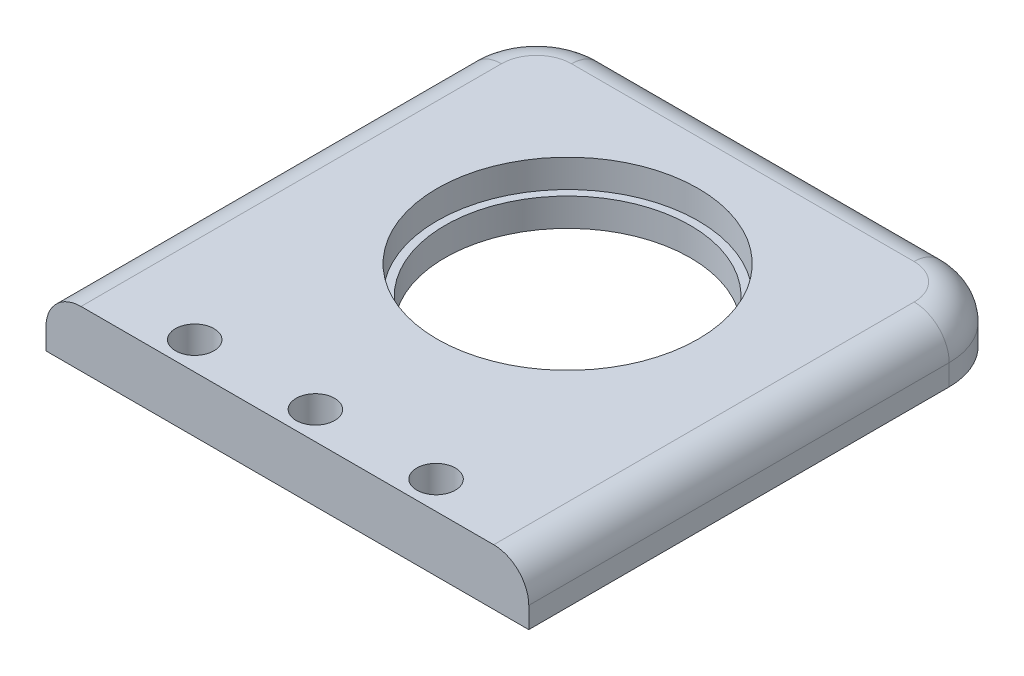
from build123d import *

# Parameters (mm, degrees)
SKETCH1_W           = 68.9
SKETCH1_H           = 70
SKETCH1_R           = 18.63
SKETCH1_R_2         = 2.75
BOSS_EXTRUDE1_DEPTH = 8
FILLET1_R           = 10
FILLET2_R           = 5
SKETCH2_R           = 18.63
SKETCH2_R_2         = 17.5
BOSS_EXTRUDE2_DEPTH = 4


with BuildPart() as part:
    # Sketch1 → Boss-Extrude1 (new body)
    with BuildSketch(Plane(origin=(0, 0, 0), x_dir=(1, 0, 0), z_dir=(0, 1, 0))):
        with Locations((0.722348924, -5)):
            Rectangle(SKETCH1_W, SKETCH1_H)
        with Locations((0.722348924, 0)):
            Circle(SKETCH1_R, mode=Mode.SUBTRACT)
        with Locations((0.722348924, -36)):
            Circle(SKETCH1_R_2, mode=Mode.SUBTRACT)
        with Locations((-16.502651076, -36)):
            Circle(SKETCH1_R_2, mode=Mode.SUBTRACT)
        with Locations((17.947348924, -36)):
            Circle(SKETCH1_R_2, mode=Mode.SUBTRACT)
    extrude(amount=BOSS_EXTRUDE1_DEPTH)

    # Fillet1
    fillet1_edges = [part.edges().sort_by_distance(p)[0] for p in [
        (35.172348924, 4, -30),
        (-33.727651076, 4, -30),
    ]]
    fillet(fillet1_edges, radius=FILLET1_R)

    # Fillet2
    fillet2_edges = [part.edges().sort_by_distance(p)[0] for p in [
        (32.243416735, 8, -27.071067812),
        (0.722348924, 8, -30),
        (-30.798718888, 8, -27.071067812),
        (35.172348924, 8, 10),
        (-33.727651076, 8, 10),
    ]]
    fillet(fillet2_edges, radius=FILLET2_R)

    # Sketch2 → Boss-Extrude2 (add)
    with BuildSketch(Plane.XZ):
        with Locations((0.722348924, 0)):
            Circle(SKETCH2_R)
        with Locations((0.722348924, 0)):
            Circle(SKETCH2_R_2, mode=Mode.SUBTRACT)
    extrude(amount=-BOSS_EXTRUDE2_DEPTH)


solid = part.part
